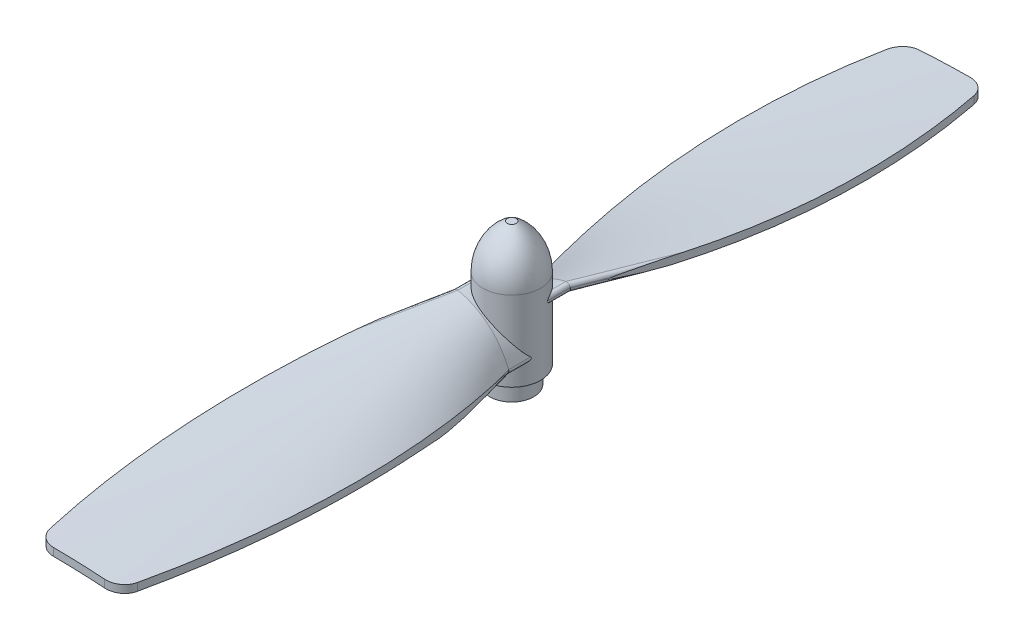
from build123d import *

# Parameters (mm, degrees)
SKETCH6_R                = 1.524
BOSS_EXTRUDE2_DEPTH      = 1.2192
SKETCH7_R                = 0.3937
CUT_EXTRUDE1_DEPTH       = 6.858
BOSS_EXTRUDE5_REACH      = 11.705
BOSS_EXTRUDE5_END_RADIUS = 1.9939
SKETCH16_OUTSIDE_W       = 29.602
SKETCH16_OUTSIDE_H       = 41.696
CUT_EXTRUDE4_DEPTH       = 6.858
FILLET3_R                = 1.27
BOSS_EXTRUDE6_REACH      = 35.444
BOSS_EXTRUDE6_END_RADIUS = 1.9939
CUT_EXTRUDE6_DEPTH       = 6.858
FILLET7_R                = 1.27


with BuildPart() as part:
    # Sketch5 → Revolve2 (revolve)
    with BuildSketch(Plane.XY):
        with BuildLine():
            Line((0, 0), (-1.9939, 0))
            Line((-1.9939, 0), (-1.9939, 5.519137791))
            ThreePointArc((-1.9939, 5.519137791), (-1.543275398, 7.258296027), (-0.3048, 8.5598))
            Line((-0.3048, 8.5598), (0, 8.5598))
            Line((0, 8.5598), (0, 0))
        make_face()
    revolve(axis=Axis((0, 8.5598, 0), (0, -1, 0)))

    # Sketch6 → Boss-Extrude2 (add)
    with BuildSketch(Plane.XZ):
        Circle(SKETCH6_R)
    extrude(amount=BOSS_EXTRUDE2_DEPTH)

    # Sketch7 → Cut-Extrude1 (cut)
    with BuildSketch(Plane.XZ.offset(1.2192)):
        Circle(SKETCH7_R)
    extrude(amount=-CUT_EXTRUDE1_DEPTH, mode=Mode.SUBTRACT)

    # Boss-Extrude5: up to this cylinder (the profile starts outside it)
    boss_extrude5_end = Plane(origin=(0, 3.24487, 0), z_dir=(0, 1, 0)) * Cylinder(BOSS_EXTRUDE5_END_RADIUS, 28.3978, mode=Mode.PRIVATE)
    # Sketch9 → Boss-Extrude5 (add, up to the surface)
    with BuildSketch(Plane.XY.offset(2.1209), mode=Mode.PRIVATE) as boss_extrude5_sk1:
        with BuildLine():
            Line((-1.907092976, 4.458479947), (-1.911009645, 4.433343752))
            ThreePointArc((-1.911009645, 4.433343752), (-1.869260012, 4.250216437), (-1.713103618, 4.145842947))
            ThreePointArc((-1.713103618, 4.145842947), (0.184361561, 3.206565272), (1.402060513, 1.474564719))
            ThreePointArc((1.402060513, 1.474564719), (1.529030572, 1.336155005), (1.716383091, 1.322825387))
            Line((1.716383091, 1.322825387), (1.740627792, 1.330530132))
            ThreePointArc((1.740627792, 1.330530132), (1.892423691, 1.462140329), (1.901122855, 1.662857951))
            ThreePointArc((1.901122855, 1.662857951), (0.531578909, 3.611479675), (-1.603133068, 4.667785511))
            ThreePointArc((-1.603133068, 4.667785511), (-1.800175369, 4.62857364), (-1.907092976, 4.458479947))
        make_face()
    boss_extrude5_tool1 = extrude(boss_extrude5_sk1.sketch, amount=-BOSS_EXTRUDE5_REACH, mode=Mode.PRIVATE) - boss_extrude5_end
    add(boss_extrude5_tool1.solids().sort_by_distance((0.217208, 3.24487, 2.1209))[0])

    # Sketch12 for Loft8 → Loft8 section 0
    with BuildSketch(Plane.XY.offset(2.1209)):
        with BuildLine():
            Line((-1.907092976, 4.458479947), (-1.911009645, 4.433343752))
            # circular arc as an exact rational Bezier (weights 1, cos(half-angle), 1)
            Bezier((-1.911009645, 4.433343752), (-1.947988572, 4.196022305), (-1.713103618, 4.145842947), weights=[1, 0.726589954, 1])
            Bezier((-1.713103618, 4.145842947), (0.571311578, 3.657814716), (1.402060513, 1.474564719), weights=[1, 0.878364383, 1])
            Bezier((1.402060513, 1.474564719), (1.487478622, 1.250081632), (1.716383091, 1.322825387), weights=[1, 0.726589954, 1])
            Line((1.716383091, 1.322825387), (1.740627792, 1.330530132))
            Bezier((1.740627792, 1.330530132), (1.996541861, 1.411857292), (1.901122855, 1.662857951), weights=[1, 0.687184271, 1])
            Bezier((1.901122855, 1.662857951), (0.967216748, 4.119507389), (-1.603133068, 4.667785511), weights=[1, 0.878215757, 1])
            Bezier((-1.603133068, 4.667785511), (-1.865750716, 4.723804155), (-1.907092976, 4.458479947), weights=[1, 0.687184271, 1])
        make_face()
    # Sketch10 for Loft8 → Loft8 section 1
    with BuildSketch(Plane.XY.offset(29.9339)):
        with BuildLine():
            Line((-9.901977991, 2.262063691), (-9.897078688, 2.237094399))
            Bezier((-9.897078688, 2.237094399), (-9.85101186, 2.002314852), (-9.6139, 2.034276611), weights=[1, 0.727917451, 1])
            Bezier((-9.6139, 2.034276611), (0.06096841, 3.338411368), (9.6139, 1.327107254), weights=[1, 0.985457533, 1])
            Bezier((9.6139, 1.327107254), (9.84802343, 1.277814174), (9.911212145, 1.508575468), weights=[1, 0.727917451, 1])
            Line((9.911212145, 1.508575468), (9.917932396, 1.533117411))
            Bezier((9.917932396, 1.533117411), (9.989146906, 1.79318841), (9.725288218, 1.848749405), weights=[1, 0.685674498, 1])
            Bezier((9.725288218, 1.848749405), (0.080871921, 3.879584037), (-9.686668701, 2.562691775), weights=[1, 0.985452994, 1])
            Bezier((-9.686668701, 2.562691775), (-9.95389591, 2.526663315), (-9.901977991, 2.262063691), weights=[1, 0.685674498, 1])
        make_face()
    loft()

    # Sketch16 outside → Cut-Extrude4 (cut)
    with BuildSketch(Plane(origin=(0, 0, 0), x_dir=(1, 0, 0), z_dir=(0, 1, 0))):
        with Locations((0.01, -13.97)):
            Rectangle(SKETCH16_OUTSIDE_W, SKETCH16_OUTSIDE_H)
        with BuildLine():
            ThreePointArc((-1.912960131, -2.122515941), (-4.082370855, -15.973438251), (-2.794, -29.9339))
            Line((-2.794, -29.9339), (2.794, -29.9339))
            ThreePointArc((2.794, -29.9339), (4.082370855, -15.973438251), (1.912960131, -2.122515941))
            Line((1.912960131, -2.122515941), (8.241150948, 0))
            Line((8.241150948, 0), (0, 7.675394645))
            Line((0, 7.675394645), (-8.49185707, 0))
            Line((-8.49185707, 0), (-1.912960131, -2.122515941))
        make_face(mode=Mode.SUBTRACT)
    extrude(amount=CUT_EXTRUDE4_DEPTH, mode=Mode.SUBTRACT)

    # Fillet3
    fillet3_edges = [part.edges().sort_by_distance(p)[0] for p in [
        (2.794, 2.601751942, 29.9339),
        (-2.794, 2.803575346, 29.9339),
    ]]
    fillet(fillet3_edges, radius=FILLET3_R)

    # Boss-Extrude6: up to this cylinder (the profile starts outside it)
    boss_extrude6_end = Plane(origin=(0, 3.24487, 0), z_dir=(0, 1, 0)) * Cylinder(BOSS_EXTRUDE6_END_RADIUS, 75.8758, mode=Mode.PRIVATE)
    # Sketch17 → Boss-Extrude6 (add, up to the surface)
    with BuildSketch(Plane.XY.offset(-2.1336), mode=Mode.PRIVATE) as boss_extrude6_sk1:
        with BuildLine():
            Line((1.910754906, 4.458479947), (1.914671575, 4.433343752))
            ThreePointArc((1.914671575, 4.433343752), (1.872921943, 4.250216437), (1.716765548, 4.145842947))
            ThreePointArc((1.716765548, 4.145842947), (-0.18069963, 3.206565272), (-1.398398582, 1.474564719))
            ThreePointArc((-1.398398582, 1.474564719), (-1.525368642, 1.336155005), (-1.712721161, 1.322825387))
            Line((-1.712721161, 1.322825387), (-1.736965861, 1.330530132))
            ThreePointArc((-1.736965861, 1.330530132), (-1.888761761, 1.462140329), (-1.897460924, 1.662857951))
            ThreePointArc((-1.897460924, 1.662857951), (-0.527916978, 3.611479675), (1.606794999, 4.667785511))
            ThreePointArc((1.606794999, 4.667785511), (1.8038373, 4.62857364), (1.910754906, 4.458479947))
        make_face()
    boss_extrude6_tool1 = extrude(boss_extrude6_sk1.sketch, amount=BOSS_EXTRUDE6_REACH, mode=Mode.PRIVATE) - boss_extrude6_end
    add(boss_extrude6_tool1.solids().sort_by_distance((-0.213547, 3.24487, -2.1336))[0])

    # Sketch19 for Loft9 → Loft9 section 0
    with BuildSketch(Plane(origin=(0, 0, -2.1336), x_dir=(-1, 0, 0), z_dir=(0, 0, -1))):
        with BuildLine():
            Line((-1.910754906, 4.458479947), (-1.914671575, 4.433343752))
            Bezier((-1.914671575, 4.433343752), (-1.951650503, 4.196022305), (-1.716765548, 4.145842947), weights=[1, 0.726589954, 1])
            Bezier((-1.716765548, 4.145842947), (0.567649647, 3.657814716), (1.398398582, 1.474564719), weights=[1, 0.878364383, 1])
            Bezier((1.398398582, 1.474564719), (1.483816691, 1.250081632), (1.712721161, 1.322825387), weights=[1, 0.726589954, 1])
            Line((1.712721161, 1.322825387), (1.736965861, 1.330530132))
            Bezier((1.736965861, 1.330530132), (1.99287993, 1.411857292), (1.897460924, 1.662857951), weights=[1, 0.687184271, 1])
            Bezier((1.897460924, 1.662857951), (0.963554818, 4.119507389), (-1.606794999, 4.667785511), weights=[1, 0.878215757, 1])
            Bezier((-1.606794999, 4.667785511), (-1.869412647, 4.723804155), (-1.910754906, 4.458479947), weights=[1, 0.687184271, 1])
        make_face()
    # Sketch18 for Loft9 → Loft9 section 1
    with BuildSketch(Plane.XY.offset(-29.9466)):
        with BuildLine():
            Line((9.91805772, 2.244346065), (9.911337468, 2.219622266))
            Bezier((9.911337468, 2.219622266), (9.852941418, 2.00478324), (9.632302502, 2.034521677), weights=[1, 0.752012972, 1])
            Bezier((9.632302502, 2.034521677), (-0.042587008, 3.338535033), (-9.595497498, 1.327107923), weights=[1, 0.985457519, 1])
            Bezier((-9.595497498, 1.327107923), (-9.847410892, 1.274065928), (-9.897062387, 1.526669451), weights=[1, 0.70233896, 1])
            Line((-9.897062387, 1.526669451), (-9.90196169, 1.551594806))
            Bezier((-9.90196169, 1.551594806), (-9.950296546, 1.797499885), (-9.705062987, 1.849133861), weights=[1, 0.711840561, 1])
            Bezier((-9.705062987, 1.849133861), (-0.060613435, 3.879774675), (9.706893932, 2.562691107), weights=[1, 0.985453015, 1])
            Bezier((9.706893932, 2.562691107), (9.994062692, 2.523968304), (9.91805772, 2.244346065), weights=[1, 0.659170495, 1])
        make_face()
    loft()

    # Sketch23 → Cut-Extrude6 (cut)
    with BuildSketch(Plane(origin=(0, 0, 0), x_dir=(1, 0, 0), z_dir=(0, 1, 0))):
        with BuildLine():
            Line((-2.793084528, 29.9466), (2.794915472, 29.9466))
            ThreePointArc((2.794915472, 29.9466), (4.230173394, 15.981472678), (1.9177, 2.134551965))
            Line((1.9177, 2.134551965), (30.72274873, 36.133293356))
            Line((30.72274873, 36.133293356), (-29.847008349, 37.90528093))
            Line((-29.847008349, 37.90528093), (-15.49185498, 1.575713795))
            Line((-15.49185498, 1.575713795), (-1.897460924, 2.1336))
            ThreePointArc((-1.897460924, 2.1336), (-4.219309922, 15.97975297), (-2.793084528, 29.9466))
        make_face()
    extrude(amount=CUT_EXTRUDE6_DEPTH, mode=Mode.SUBTRACT)

    # Fillet7
    fillet7_edges = [part.edges().sort_by_distance(p)[0] for p in [
        (-2.793084528, 2.600343391, -29.9466),
        (2.794915472, 2.803959919, -29.9466),
    ]]
    fillet(fillet7_edges, radius=FILLET7_R)


solid = part.part
